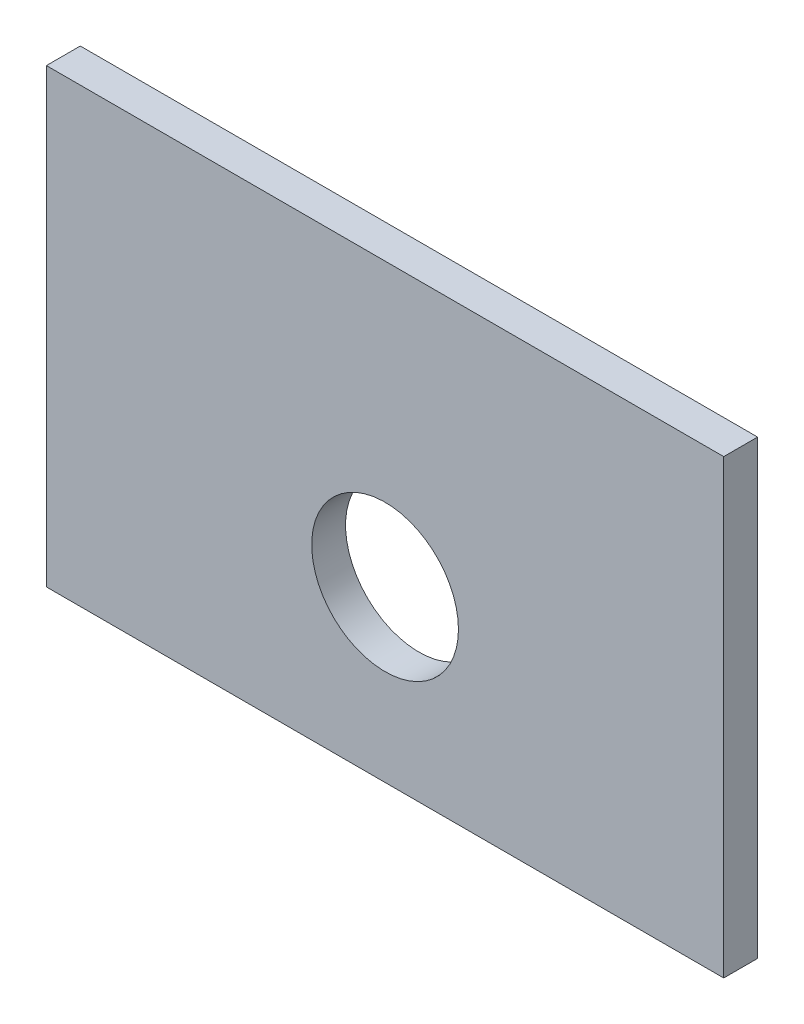
from build123d import *

# Parameters (mm, degrees)
SKETCH1_W          = 30
SKETCH1_H          = 20
SKETCH1_R          = 3.25
BASE_FLANGE1_DEPTH = 1.5


# Sheet-metal steps are written as plain solids
with BuildPart() as part:
    # Sketch1 → Base-Flange1 (new body)
    with BuildSketch(Plane.XY):
        with Locations((15, 10)):
            Rectangle(SKETCH1_W, SKETCH1_H)
        with Locations((15, 7.5)):
            Circle(SKETCH1_R, mode=Mode.SUBTRACT)
    extrude(amount=-BASE_FLANGE1_DEPTH)


solid = part.part
